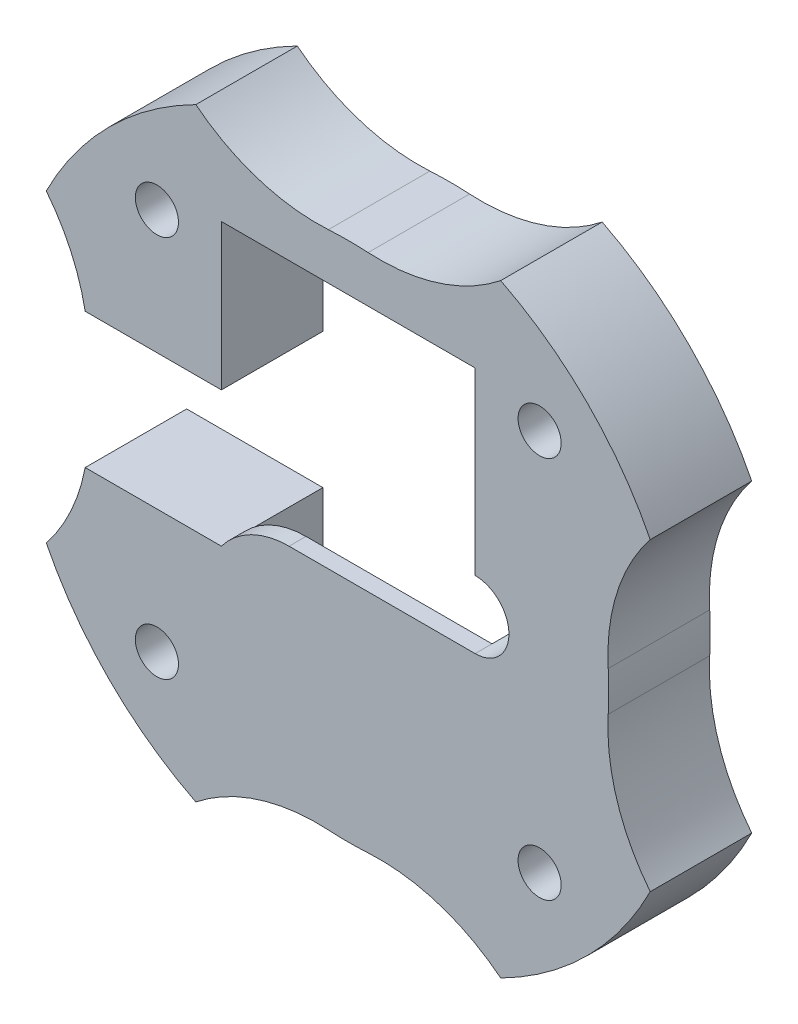
from build123d import *

# Parameters (mm, degrees)
SKETCH1_R           = 2.55
BOSS_EXTRUDE2_DEPTH = 10
SKETCH2_R           = 2.55
BOSS_EXTRUDE3_DEPTH = 2
SKETCH3_W           = 30
SKETCH3_H           = 2
CUT_EXTRUDE1_DEPTH  = 35
SKETCH4_W           = 19.809531665
SKETCH4_H           = 16
CUT_EXTRUDE2_DEPTH  = 19
FILLET1_R           = 10


with BuildPart() as part:
    # Sketch1 → Boss-Extrude2 (new body)
    with BuildSketch(Plane.XY):
        with BuildLine():
            ThreePointArc((18.024150889, 186.79103775), (10.644862344, 190.724335457), (2.347067513, 191.759386777))
            ThreePointArc((2.347067513, 191.759386777), (0, 191.690468331), (-2.347067513, 191.759386777))
            ThreePointArc((-2.347067513, 191.759386777), (-10.644862344, 190.724335457), (-18.024150889, 186.79103775))
            ThreePointArc((-18.024150889, 186.79103775), (-28.284271247, 194.215728749), (-35.708962247, 204.475849108))
            ThreePointArc((-35.708962247, 204.475849108), (-31.77566454, 211.855137653), (-30.74061322, 220.152932484))
            ThreePointArc((-30.74061322, 220.152932484), (-30.809531665, 222.499999997), (-30.74061322, 224.84706751))
            ThreePointArc((-30.74061322, 224.84706751), (-31.77566454, 233.14486234), (-35.708962247, 240.524150885))
            ThreePointArc((-35.708962247, 240.524150885), (-28.284271247, 250.784271244), (-18.024150889, 258.208962244))
            ThreePointArc((-18.024150889, 258.208962244), (-10.644862344, 254.275664537), (-2.347067513, 253.240613217))
            ThreePointArc((-2.347067513, 253.240613217), (0, 253.309531662), (2.347067513, 253.240613217))
            ThreePointArc((2.347067513, 253.240613217), (10.644862344, 254.275664537), (18.024150889, 258.208962244))
            ThreePointArc((18.024150889, 258.208962244), (28.284271247, 250.784271244), (35.708962247, 240.524150885))
            ThreePointArc((35.708962247, 240.524150885), (31.77566454, 233.14486234), (30.74061322, 224.84706751))
            ThreePointArc((30.74061322, 224.84706751), (30.809531665, 222.499999997), (30.74061322, 220.152932484))
            ThreePointArc((30.74061322, 220.152932484), (31.77566454, 211.855137653), (35.708962247, 204.475849108))
            ThreePointArc((35.708962247, 204.475849108), (28.284271247, 194.215728749), (18.024150889, 186.79103775))
        make_face()
        with Locations((-22.627416998, 245.127416995)):
            Circle(SKETCH1_R, mode=Mode.SUBTRACT)
        with Locations((-22.627416998, 199.872582999)):
            Circle(SKETCH1_R, mode=Mode.SUBTRACT)
        with Locations((22.627416998, 199.872582999)):
            Circle(SKETCH1_R, mode=Mode.SUBTRACT)
        with Locations((22.627416998, 245.127416995)):
            Circle(SKETCH1_R, mode=Mode.SUBTRACT)
        with BuildLine():
            Line((-15, 218.499999997), (-15, 199.25))
            Line((-15, 199.25), (15, 199.25))
            Line((15, 199.25), (15, 218.499999997))
            ThreePointArc((15, 218.499999997), (19, 222.499999997), (15, 226.499999997))
            Line((15, 226.499999997), (15, 245.749999994))
            Line((15, 245.749999994), (-15, 245.749999994))
            Line((-15, 245.749999994), (-15, 226.499999997))
            ThreePointArc((-15, 226.499999997), (-19, 222.499999997), (-15, 218.499999997))
        make_face(mode=Mode.SUBTRACT)
    extrude(amount=BOSS_EXTRUDE2_DEPTH)

    # Sketch2 → Boss-Extrude3 (add)
    with BuildSketch(Plane.XY.offset(10)):
        with BuildLine():
            ThreePointArc((18.024150889, 186.79103775), (28.284271247, 194.215728749), (35.708962247, 204.475849108))
            ThreePointArc((35.708962247, 204.475849108), (31.77566454, 211.855137653), (30.74061322, 220.152932484))
            ThreePointArc((30.74061322, 220.152932484), (30.809531665, 222.499999997), (30.74061322, 224.84706751))
            ThreePointArc((30.74061322, 224.84706751), (31.77566454, 233.14486234), (35.708962247, 240.524150885))
            ThreePointArc((35.708962247, 240.524150885), (28.284271247, 250.784271244), (18.024150889, 258.208962244))
            ThreePointArc((18.024150889, 258.208962244), (10.644862344, 254.275664537), (2.347067513, 253.240613217))
            ThreePointArc((2.347067513, 253.240613217), (0, 253.309531662), (-2.347067513, 253.240613217))
            ThreePointArc((-2.347067513, 253.240613217), (-10.644862344, 254.275664537), (-18.024150889, 258.208962244))
            ThreePointArc((-18.024150889, 258.208962244), (-28.284271247, 250.784271244), (-35.708962247, 240.524150885))
            ThreePointArc((-35.708962247, 240.524150885), (-31.77566454, 233.14486234), (-30.74061322, 224.84706751))
            ThreePointArc((-30.74061322, 224.84706751), (-30.809531665, 222.499999997), (-30.74061322, 220.152932484))
            ThreePointArc((-30.74061322, 220.152932484), (-31.77566454, 211.855137653), (-35.708962247, 204.475849108))
            ThreePointArc((-35.708962247, 204.475849108), (-28.284271247, 194.215728749), (-18.024150889, 186.79103775))
            ThreePointArc((-18.024150889, 186.79103775), (-10.644862344, 190.724335457), (-2.347067513, 191.759386777))
            ThreePointArc((-2.347067513, 191.759386777), (0, 191.690468331), (2.347067513, 191.759386777))
            ThreePointArc((2.347067513, 191.759386777), (10.644862344, 190.724335457), (18.024150889, 186.79103775))
        make_face()
        with Locations((-22.627416998, 245.127416995)):
            Circle(SKETCH2_R, mode=Mode.SUBTRACT)
        with Locations((-22.627416998, 199.872582999)):
            Circle(SKETCH2_R, mode=Mode.SUBTRACT)
        with Locations((22.627416998, 199.872582999)):
            Circle(SKETCH2_R, mode=Mode.SUBTRACT)
        with Locations((22.627416998, 245.127416995)):
            Circle(SKETCH2_R, mode=Mode.SUBTRACT)
        with BuildLine():
            Line((-15, 245.749999994), (-15, 226.499999997))
            ThreePointArc((-15, 226.499999997), (-19, 222.499999997), (-15, 218.499999997))
            Line((-15, 218.499999997), (15, 218.499999997))
            ThreePointArc((15, 218.499999997), (19, 222.499999997), (15, 226.499999997))
            Line((15, 226.499999997), (15, 245.749999994))
            Line((15, 245.749999994), (-15, 245.749999994))
        make_face(mode=Mode.SUBTRACT)
    extrude(amount=BOSS_EXTRUDE3_DEPTH)

    # Sketch3 → Cut-Extrude1 (cut)
    with BuildSketch(Plane.XY.offset(12)):
        with Locations((0, 246.749999994)):
            Rectangle(SKETCH3_W, SKETCH3_H)
    extrude(amount=-CUT_EXTRUDE1_DEPTH, mode=Mode.SUBTRACT)

    # Sketch4 → Cut-Extrude2 (cut)
    with BuildSketch(Plane(origin=(0, 0, 0), x_dir=(-1, 0, 0), z_dir=(0, 0, -1))):
        with Locations((24.904765833, 222.499999997)):
            Rectangle(SKETCH4_W, SKETCH4_H)
    extrude(amount=-CUT_EXTRUDE2_DEPTH, mode=Mode.SUBTRACT)

    # Fillet1
    # the kernel refuses this fillet: 10 mm, written as the material it takes off along each edge
    with BuildSketch(Plane(origin=(-15, 218.499999997, -10), x_dir=(0, -1, 0), z_dir=(0, 0, 1))) as fillet1_piece_1:
        with BuildLine():
            CenterArc((10, 8), FILLET1_R, 180, 53.130102354)
            Line((0, 8), (-0.2, 8))
            Line((-0.2, 8), (-0.2, 0))
            Line((-0.2, 0), (0, -0.2))
            ThreePointArc((0, -0.2), (2, -0.2), (3.88, -0.16))
            Line((3.88, -0.16), (4, 0))
        make_face()
    extrude(amount=42, mode=Mode.SUBTRACT)


solid = part.part
